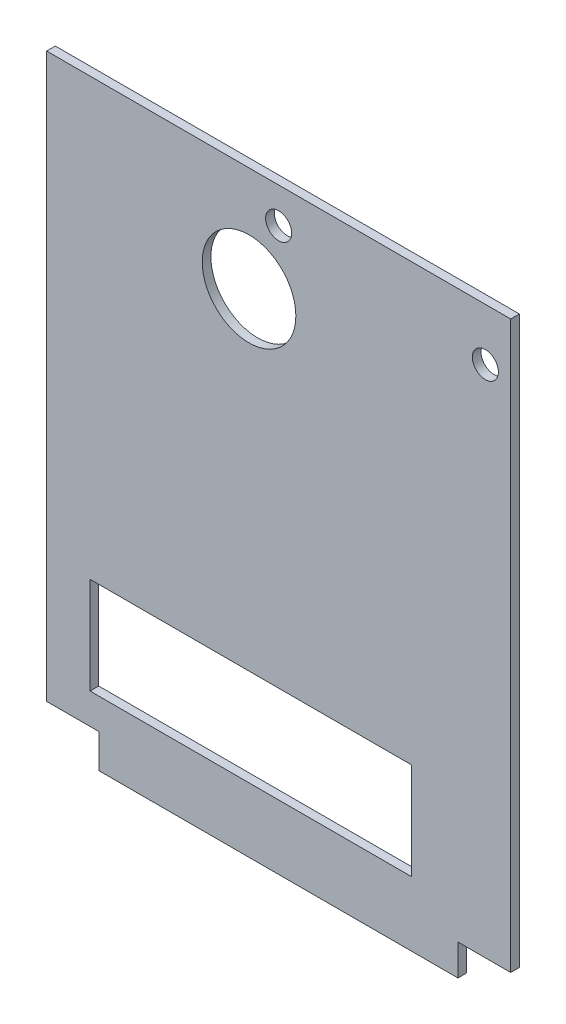
from build123d import *

# Parameters (mm, degrees)
SKETCH1_W           = 81.534
SKETCH1_H           = 104.902
BOSS_EXTRUDE1_DEPTH = 1.524
SKETCH2_W           = 9.17
SKETCH2_H           = 5.95
SKETCH2_W_2         = 9.266089767
SKETCH2_H_2         = 5.472
CUT_EXTRUDE1_DEPTH  = 1.524
SKETCH4_W           = 56.5
SKETCH4_H           = 17
CUT_EXTRUDE2_DEPTH  = 1.524
SKETCH6_R           = 2.285
CUT_EXTRUDE3_DEPTH  = 1.524
SKETCH8_R           = 8.224077239
CUT_EXTRUDE4_DEPTH  = 2.54


with BuildPart() as part:
    # Sketch1 → Boss-Extrude1 (new body)
    with BuildSketch(Plane.XY):
        with Locations((-2.046973799, -6.087681223)):
            Rectangle(SKETCH1_W, SKETCH1_H)
    extrude(amount=BOSS_EXTRUDE1_DEPTH)

    # Sketch2 → Cut-Extrude1 (cut)
    with BuildSketch(Plane.XY.offset(1.524)):
        with Locations((-38.228973799, -55.563681223)):
            Rectangle(SKETCH2_W, SKETCH2_H)
        with Locations((34.086981318, -55.802681223)):
            Rectangle(SKETCH2_W_2, SKETCH2_H_2)
    extrude(amount=-CUT_EXTRUDE1_DEPTH, mode=Mode.SUBTRACT)

    # Sketch4 → Cut-Extrude2 (cut)
    with BuildSketch(Plane.XY.offset(1.524)):
        with Locations((-6.933973799, -38.698681223)):
            Rectangle(SKETCH4_W, SKETCH4_H)
    extrude(amount=-CUT_EXTRUDE2_DEPTH, mode=Mode.SUBTRACT)

    # Sketch6 → Cut-Extrude3 (cut)
    with BuildSketch(Plane.XY.offset(1.524)):
        with Locations((-2.046973799, 40.158318777)):
            Circle(SKETCH6_R)
        with Locations((34.265026201, 37.193318777)):
            Circle(SKETCH6_R)
    extrude(amount=-CUT_EXTRUDE3_DEPTH, mode=Mode.SUBTRACT)

    # Sketch8 → Cut-Extrude4 (cut)
    with BuildSketch(Plane.XY.offset(1.524)):
        with Locations((-7.253098943, 27.957244975)):
            Circle(SKETCH8_R)
    extrude(amount=-CUT_EXTRUDE4_DEPTH, mode=Mode.SUBTRACT)


solid = part.part
